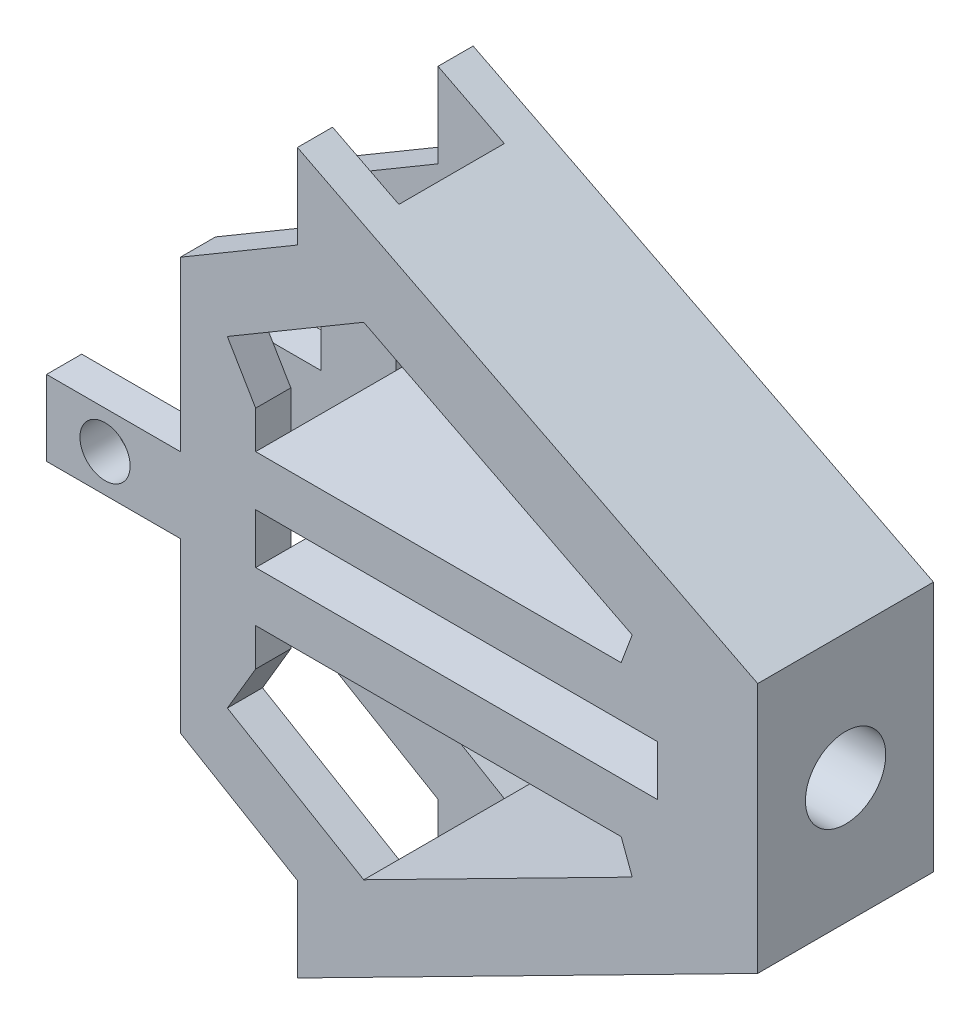
from build123d import *

# Parameters (mm, degrees)
EXTRUDE_1_DEPTH     = 4
SKETCH_2_R          = 0.9
CUT_EXTRUDE_1_DEPTH = 52
SKETCH_3_W          = 2.000000328
SKETCH_3_H          = 4.999999888
EXTRUDE_2_DEPTH     = 1.5
EXTRUDE_3_DEPTH     = 4
EXTRUDE_4_DEPTH     = 1.5
CUT_EXTRUDE_2_DEPTH = 2
SKETCH_8_W          = 56.707929928
SKETCH_8_H          = 61.814331201
CUT_EXTRUDE_3_DEPTH = 10
EXTRUDE_5_DEPTH     = 2
CUT_EXTRUDE_5_DEPTH = 2.1
SKETCH_12_W         = 5.329837581
SKETCH_12_H         = 3.000000026
SKETCH_12_R         = 1
EXTRUDE_6_DEPTH     = 1.4
SKETCH_13_W         = 16.000000485
SKETCH_13_H         = 2
CUT_EXTRUDE_6_DEPTH = 71.818335642
EXTRUDE_7_DEPTH     = 3.5
SKETCH_10_R         = 1.6
CUT_EXTRUDE_7_DEPTH = 33.219032999


with BuildPart() as part:
    # 草图1 → 凸台-拉伸1 (new body)
    with BuildSketch(Plane.XY):
        with BuildLine():
            Line((66.000003368, -0.999999465), (66.000003368, 1.000000862))
            ThreePointArc((66.000003368, 1.000000862), (65.646447605, 1.853552596), (66.500000656, 1.500000013))
            Line((66.500000656, 1.500000013), (69.000001997, 1.500000013))
            Line((69.000001997, 1.500000013), (69.000001997, 4.999999655))
            Line((69.000001997, 4.999999655), (40.0000019, 19.749999745))
            Line((40.0000019, 19.749999745), (37.000001874, 19.749999745))
            Line((37.000001874, 19.749999745), (37.000001874, 17.250002129))
            ThreePointArc((37.000001874, 17.250002129), (37.353555819, 16.396448761), (36.500001792, 16.750001116))
            Line((36.500001792, 16.750001116), (34.500001871, 16.750001116))
            ThreePointArc((34.500001871, 16.750001116), (33.646447808, 16.396448765), (34.000001848, 17.250002129))
            Line((34.000001848, 17.250002129), (34.000001848, 19.749999745))
            Line((34.000001848, 19.749999745), (31.000001822, 19.749999745))
            Line((31.000001822, 19.749999745), (31.000001822, 16.750001116))
            Line((31.000001822, 16.750001116), (34.000001848, 13.000000967))
            Line((34.000001848, 13.000000967), (34.000001848, 2.500000177))
            Line((34.000001848, 2.500000177), (19.492642954, 2.500000177))
            Line((19.492642954, 2.500000177), (10.000001639, 13.915917603))
            Line((10.000001639, 13.915917603), (10.000001639, 19.749999745))
            Line((10.000001639, 19.749999745), (7.000001147, 19.749999745))
            Line((7.000001147, 19.749999745), (7.000001147, 17.250002129))
            ThreePointArc((7.000001147, 17.250002129), (7.353556004, 16.396449439), (6.500001997, 16.750001116))
            Line((6.500001997, 16.750001116), (3.500001505, 16.750001116))
            ThreePointArc((3.500001505, 16.750001116), (2.646447808, 16.396449749), (3.000002354, 17.250002129))
            Line((3.000002354, 17.250002129), (3.000002354, 19.749999745))
            Line((3.000002354, 19.749999745), (0, 19.749999745))
            Line((0, 19.749999745), (0, -19.749999745))
            Line((0, -19.749999745), (3.000002354, -19.749999745))
            Line((3.000002354, -19.749999745), (3.000002354, -17.249999742))
            ThreePointArc((3.000002354, -17.249999742), (2.646448465, -16.39644732), (3.500001505, -16.749999719))
            Line((3.500001505, -16.749999719), (6.500001997, -16.749999719))
            ThreePointArc((6.500001997, -16.749999719), (7.353555348, -16.396447009), (7.000001147, -17.249999742))
            Line((7.000001147, -17.249999742), (7.000001147, -19.749999745))
            Line((7.000001147, -19.749999745), (10.000001639, -19.749999745))
            Line((10.000001639, -19.749999745), (10.000001639, -13.915917138))
            Line((10.000001639, -13.915917138), (19.492642954, -2.499999711))
            Line((19.492642954, -2.499999711), (34.000001848, -2.499999711))
            Line((34.000001848, -2.499999711), (34.000001848, -12.999999803))
            Line((34.000001848, -12.999999803), (31.000001822, -16.749999719))
            Line((31.000001822, -16.749999719), (31.000001822, -19.749999745))
            Line((31.000001822, -19.749999745), (34.000001848, -19.749999745))
            Line((34.000001848, -19.749999745), (34.000001848, -17.249999742))
            ThreePointArc((34.000001848, -17.249999742), (33.646448464, -16.396446335), (34.500001871, -16.749999719))
            Line((34.500001871, -16.749999719), (36.500001792, -16.749999719))
            ThreePointArc((36.500001792, -16.749999719), (37.353555162, -16.396446331), (37.000001874, -17.249999742))
            Line((37.000001874, -17.249999742), (37.000001874, -19.749999745))
            Line((37.000001874, -19.749999745), (40.0000019, -19.749999745))
            Line((40.0000019, -19.749999745), (69.000001997, -5.000000121))
            Line((69.000001997, -5.000000121), (69.000001997, -1.499999547))
            Line((69.000001997, -1.499999547), (66.500000656, -1.499999547))
            ThreePointArc((66.500000656, -1.499999547), (65.646447327, -1.853550818), (66.000003368, -0.999999465))
        make_face()
        Polygon((37.000001874, 13.000000967), (37.000001874, 1.500000013), (46.000001952, 1.500000013), (46.000001952, 4.500000505), (40.0000019, 14.666666044), align=None, mode=Mode.SUBTRACT)
        Polygon((42.838321999, -14.940624125), (49.000001512, -4.500000039), (49.000001512, -1.499999547), (63.000001013, -1.499999547), (64.000001177, -4.17735544), align=None, mode=Mode.SUBTRACT)
        Polygon((46.000001952, -1.499999547), (37.000001874, -1.499999547), (37.000001874, -12.999999803), (40.0000019, -14.666666277), (46.000001952, -4.500000039), align=None, mode=Mode.SUBTRACT)
        Polygon((63.000001013, 1.500000013), (64.000001177, 4.177356837), (42.838321999, 14.940623892), (49.000001512, 4.500000505), (49.000001512, 1.500000013), align=None, mode=Mode.SUBTRACT)
        Polygon((3.000002354, -13.749999693), (7.000001147, -13.749999693), (18.065146907, -1.59e-07), (7.000001147, 13.750000624), (3.000002354, 13.750000624), align=None, mode=Mode.SUBTRACT)
    extrude(amount=EXTRUDE_1_DEPTH)

    # 草图2 → 切除-拉伸1 (cut)
    with BuildSketch(Plane.XZ.offset(16.749999719)):
        with Locations((5.000002354, 2)):
            Circle(SKETCH_2_R)
    extrude(amount=-CUT_EXTRUDE_1_DEPTH, mode=Mode.SUBTRACT)

    # 草图3 → 凸台-拉伸2 (add)
    with BuildSketch(Plane.XY.offset(4)):
        Polygon((3.000002354, 12.413031189), (3.000002354, 13.750000624), (0, 12.680980144), (0, 10.680979816), align=None)
        with Locations((23.000001907, 2.33e-07)):
            Rectangle(SKETCH_3_W, SKETCH_3_H)
        Polygon((3.000002354, -13.749999693), (3.000002354, -12.413030723), (0, -10.680979816), (0, -12.680979678), align=None)
    extrude(amount=EXTRUDE_2_DEPTH)

    # 草图5 → 凸台-拉伸3 (add)
    with BuildSketch(Plane.XY):
        Polygon((37.000001874, 7.25000049), (44.377050947, 7.25000049), (50.66399207, 10.960326481), (53.305912072, 9.616591408), (45.647685021, 5.0969819), (37.000001874, 5.0969819), align=None)
        Polygon((37.000001874, -5.0969819), (45.647685021, -5.0969819), (53.305912072, -9.616591408), (50.66399207, -10.960326481), (44.377050947, -7.25000049), (37.000001874, -7.25000049), align=None)
    extrude(amount=EXTRUDE_3_DEPTH)

    # 草图6 → 凸台-拉伸4 (add)
    with BuildSketch(Plane.XY.offset(4)):
        Polygon((46.000001952, 1.500000013), (46.000001952, 8.207807662), (50.66399207, 10.960326481), (50.66399207, 14.326073696), (69.000001997, 4.999999655), (69.000001997, -4.999999655), (50.66399207, -14.326073696), (50.66399207, -10.960326481), (46.000001952, -8.207807662), (46.000001952, -1.500000013), align=None)
        Polygon((47.872719576, 6.410117076), (49.000001512, 4.500000505), (49.000001512, 1.500000013), (63.000001013, 1.500000013), (64.000001177, 4.177356837), (53.305912072, 9.616591408), align=None, mode=Mode.SUBTRACT)
        Polygon((47.872719428, -6.410116989), (53.305912072, -9.616591408), (64.000001177, -4.17735544), (63.000001013, -1.499999547), (49.000001512, -1.499999547), (49.000001512, -4.500000039), align=None, mode=Mode.SUBTRACT)
    extrude_4 = extrude(amount=EXTRUDE_4_DEPTH)

    # 镜向1: 凸台-拉伸4 across plane
    add(extrude_4.mirror(Plane.XY.offset(2)))

    # 草图7 → 切除-拉伸2 (cut, symmetric)
    with BuildSketch(Plane.XY.offset(2)):
        Polygon((53.305912072, 9.616591408), (53.305912072, 26.339155223), (-8.888654397, 26.339155223), (-8.888654397, -26.339155223), (53.305912072, -26.339155223), (53.305912072, -9.616591408), (47.872719576, -6.410117076), (49.000001512, -4.500000505), (49.000001512, -1.500000013), (49.000001512, 1.500000013), (49.000001512, 4.500000505), (47.872719576, 6.410117076), align=None)
    extrude(amount=CUT_EXTRUDE_2_DEPTH, both=True, mode=Mode.SUBTRACT)


with BuildPart() as cut_extrude_2_piece_1:
    # of the separate pieces the step leaves, piece 1, a body of its own (cut_extrude_2_pieces)
    add(part.part.solids().sort_by_distance((50.66399207, 10.960326481, 0))[0])

    # 草图9 → 凸台-拉伸5 (add, symmetric)
    with BuildSketch(Plane.XY.offset(2)):
        with BuildLine():
            Line((66.500000656, -1.499999547), (69.000001997, -1.499999547))
            Line((69.000001997, -1.499999547), (69.000001997, 1.500000013))
            Line((69.000001997, 1.500000013), (66.500000656, 1.500000013))
            ThreePointArc((66.500000656, 1.500000013), (65.646447605, 1.853552596), (66.000003368, 1.000000862))
            Line((66.000003368, 1.000000862), (66.000003368, -0.999999465))
            ThreePointArc((66.000003368, -0.999999465), (65.646447327, -1.853550818), (66.500000656, -1.499999547))
        make_face()
    extrude(amount=EXTRUDE_5_DEPTH, both=True)

    # 草图11 → 切除-拉伸5 (cut, symmetric)
    with BuildSketch(Plane.XY.offset(2)):
        Polygon((49.000001512, -4.500000039), (47.872719428, -6.410116989), (53.305912072, -9.616591408), (53.305912072, -12.982338518), (50.66399207, -14.326073696), (50.66399207, -10.960326481), (46.000001952, -8.207807662), (46.000001952, 8.207807662), (50.66399207, 10.960326481), (50.66399207, 14.326073696), (53.305912072, 12.982338518), (53.305912072, 9.616591408), (47.872719576, 6.410117076), (49.000001512, 4.500000505), align=None)
    extrude(amount=CUT_EXTRUDE_5_DEPTH, both=True, mode=Mode.SUBTRACT)

    # 草图12 → 凸台-拉伸6 (add)
    with BuildSketch(Plane.XY.offset(5.5)):
        with Locations((43.335083162, 0)):
            Rectangle(SKETCH_12_W, SKETCH_12_H)
        with Locations((43.000001952, 0)):
            Circle(SKETCH_12_R, mode=Mode.SUBTRACT)
    extrude_6 = extrude(amount=-EXTRUDE_6_DEPTH)

    # 镜向2: 凸台-拉伸6 across plane
    add(extrude_6.mirror(Plane.XY.offset(2)))

    # 草图13 → 切除-拉伸6 (cut, through all)
    with BuildSketch(Plane.XY.offset(5.5)):
        with Locations((57.000001755, 0)):
            Rectangle(SKETCH_13_W, SKETCH_13_H)
    extrude(amount=-CUT_EXTRUDE_6_DEPTH, mode=Mode.SUBTRACT)


with BuildPart() as cut_extrude_2_piece_2:
    # of the separate pieces the step leaves, piece 2, a body of its own (cut_extrude_2_pieces)
    add(part.part.solids().sort_by_distance((24.000002071, -2.499999711, 4))[0])


with BuildPart() as cut_extrude_2_piece_3:
    # of the separate pieces the step leaves, piece 3, a body of its own (cut_extrude_2_pieces)
    add(part.part.solids().sort_by_distance((0, 12.680980144, 4))[0])


with BuildPart() as cut_extrude_2_piece_4:
    # of the separate pieces the step leaves, piece 4, a body of its own (cut_extrude_2_pieces)
    add(part.part.solids().sort_by_distance((0, -12.680979678, 4))[0])


with BuildPart() as cut_extrude_3_tool:
    # 草图8 → 切除-拉伸3 (new body)
    with BuildSketch(Plane.XY.offset(2)):
        with Locations((4.165748407, 0.134378981)):
            Rectangle(SKETCH_8_W, SKETCH_8_H)
    extrude(amount=CUT_EXTRUDE_3_DEPTH)


with BuildPart() as cut_extrude_2_piece_2_1:
    add(cut_extrude_2_piece_2.part)

    # 切除-拉伸3: cut by cut_extrude_3_tool
    add(cut_extrude_3_tool.part, mode=Mode.SUBTRACT)


with BuildPart() as cut_extrude_2_piece_3_1:
    add(cut_extrude_2_piece_3.part)

    # 切除-拉伸3: cut by cut_extrude_3_tool
    add(cut_extrude_3_tool.part, mode=Mode.SUBTRACT)


with BuildPart() as cut_extrude_2_piece_4_1:
    add(cut_extrude_2_piece_4.part)

    # 切除-拉伸3: cut by cut_extrude_3_tool
    add(cut_extrude_3_tool.part, mode=Mode.SUBTRACT)


with BuildPart() as extrude_7_tool:
    # 草图14 → 凸台-拉伸7 (new, symmetric)
    with BuildSketch(Plane.XY.offset(2)):
        Polygon((49.000001512, 3.000000013), (63.560255154, 3.000000013), (63.000001013, 1.500000013), (49.000001512, 1.500000013), align=None)
        Polygon((49.000001512, -3.000000013), (49.000001512, -1.500000013), (63.000001013, -1.500000013), (63.560255154, -3.000000013), align=None)
    extrude(amount=EXTRUDE_7_DEPTH, both=True)


with BuildPart() as cut_extrude_2_piece_1_1:
    add(cut_extrude_2_piece_1.part)


with BuildPart() as cut_extrude_2_piece_1_2:
    # 凸台-拉伸7: joined with extrude_7_tool
    add(cut_extrude_2_piece_1_1.part.fuse(extrude_7_tool.part, tol=0.00001))

    # 草图10 → 切除-拉伸7 (cut, through all)
    with BuildSketch(Plane(origin=(69.000001997, 0, 0), x_dir=(0, 0, -1), z_dir=(1, 0, 0))):
        with Locations((-2, 0)):
            Circle(SKETCH_10_R)
    extrude(amount=-CUT_EXTRUDE_7_DEPTH, mode=Mode.SUBTRACT)


solid = cut_extrude_2_piece_1_2.part
